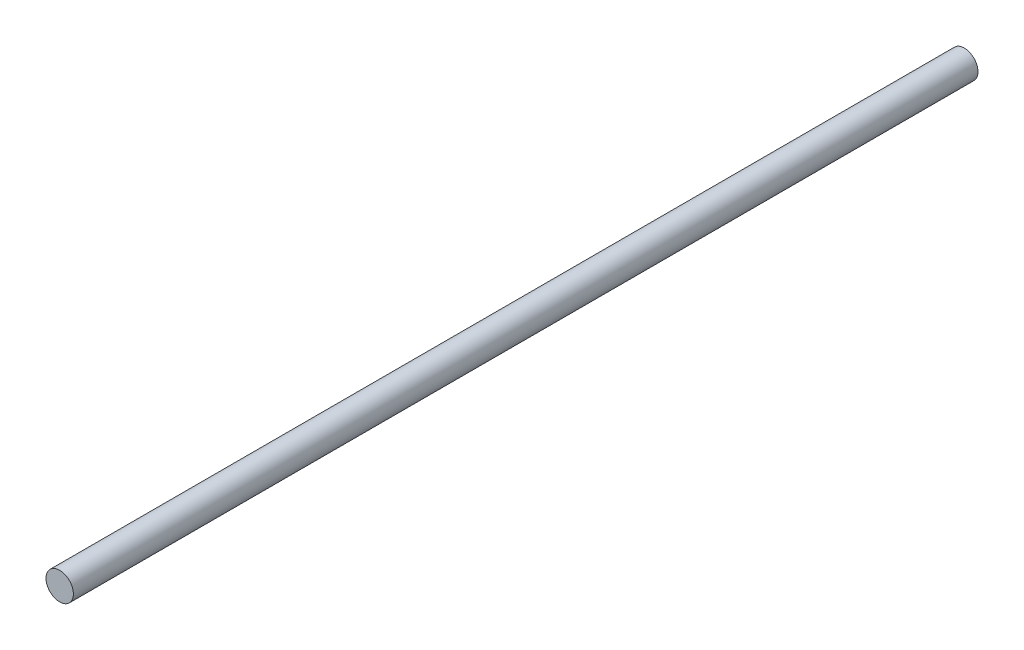
from build123d import *

# Parameters (mm, degrees)
SKETCH1_R           = 3.175
BOSS_EXTRUDE1_DEPTH = 209.55


with BuildPart() as part:
    # Sketch1 → Boss-Extrude1 (new body)
    with BuildSketch(Plane.XY):
        Circle(SKETCH1_R)
    extrude(amount=BOSS_EXTRUDE1_DEPTH)


solid = part.part
